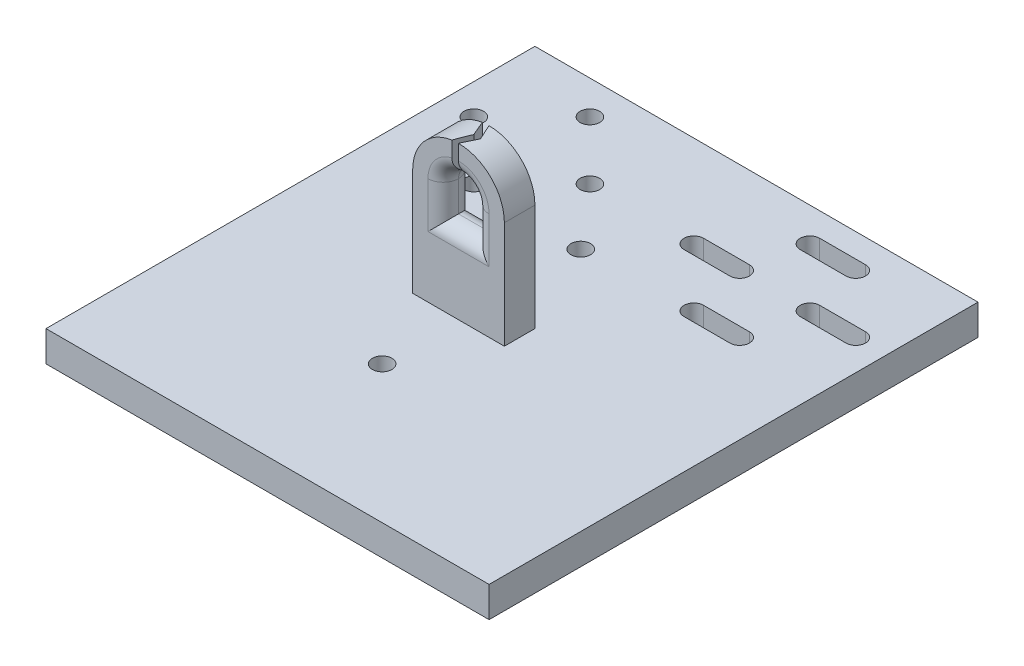
from build123d import *

# Parameters (mm, degrees)
SKETCH2_W           = 65
SKETCH2_H           = 30
BOSS_EXTRUDE1_DEPTH = 5
SKETCH3_R           = 1.6
CUT_EXTRUDE1_DEPTH  = 37.142080737
SKETCH5_W           = 30
SKETCH5_H           = 5
BOSS_EXTRUDE2_DEPTH = 7.5
CUT_EXTRUDE2_DEPTH  = 10
SKETCH7_W           = 72.5
SKETCH7_H           = 5
BOSS_EXTRUDE3_DEPTH = 50
BOSS_EXTRUDE4_DEPTH = 5
BOSS_EXTRUDE5_DEPTH = 5
SKETCH6_R           = 1.6
CUT_EXTRUDE3_DEPTH  = 10
CUT_EXTRUDE4_DEPTH  = 79.302298817
FILLET1_R           = 2.5


with BuildPart() as part:
    # Sketch2 → Boss-Extrude1 (new body)
    with BuildSketch(Plane(origin=(0, 0, 0), x_dir=(1, 0, 0), z_dir=(0, 1, 0))):
        Rectangle(SKETCH2_W, SKETCH2_H)
    extrude(amount=BOSS_EXTRUDE1_DEPTH)

    # Sketch3 → Cut-Extrude1 (cut, through all)
    with BuildSketch(Plane(origin=(0, 5, 0), x_dir=(1, 0, 0), z_dir=(0, 1, 0))):
        with Locations(Location((-27.5, 0, 0), (0, 0, 270))):
            Circle(SKETCH3_R)
        with Locations(Location((-18, 9.5, 0), (0, 0, 270))):
            Circle(SKETCH3_R)
        with Locations(Location((-8.5, 0, 0), (0, 0, 270))):
            Circle(SKETCH3_R)
        with Locations(Location((-18, -9.5, 0), (0, 0, 270))):
            Circle(SKETCH3_R)
        with Locations(Location((18, -9.5, 0), (0, 0, 90))):
            Circle(SKETCH3_R)
        with Locations(Location((27.5, 0, 0), (0, 0, 90))):
            Circle(SKETCH3_R)
        with Locations(Location((18, 9.5, 0), (0, 0, 90))):
            Circle(SKETCH3_R)
        with Locations(Location((8.5, 0, 0), (0, 0, 90))):
            Circle(SKETCH3_R)
    extrude(amount=-CUT_EXTRUDE1_DEPTH, mode=Mode.SUBTRACT)

    # Sketch5 → Boss-Extrude2 (add)
    with BuildSketch(Plane(origin=(32.5, 0, 0), x_dir=(0, 0, -1), z_dir=(1, 0, 0))):
        with Locations((0, 2.5)):
            Rectangle(SKETCH5_W, SKETCH5_H)
    extrude(amount=BOSS_EXTRUDE2_DEPTH)

    # Sketch4 → Cut-Extrude2 (cut)
    with BuildSketch(Plane(origin=(0, 5, 0), x_dir=(1, 0, 0), z_dir=(0, 1, 0))):
        with BuildLine():
            Line((8.5, 1.6), (16, 1.6))
            ThreePointArc((16, 1.6), (17.6, 0), (16, -1.6))
            Line((16, -1.6), (8.5, -1.6))
            ThreePointArc((8.5, -1.6), (6.9, 0), (8.5, 1.6))
        make_face()
        with BuildLine():
            Line((27.5, 1.6), (35, 1.6))
            ThreePointArc((35, 1.6), (36.6, 0), (35, -1.6))
            Line((35, -1.6), (27.5, -1.6))
            ThreePointArc((27.5, -1.6), (25.9, 0), (27.5, 1.6))
        make_face()
        with BuildLine():
            Line((18, -7.9), (25.5, -7.9))
            ThreePointArc((25.5, -7.9), (27.1, -9.5), (25.5, -11.1))
            Line((25.5, -11.1), (18, -11.1))
            ThreePointArc((18, -11.1), (16.4, -9.5), (18, -7.9))
        make_face()
        with BuildLine():
            Line((18, 11.1), (25.5, 11.1))
            ThreePointArc((25.5, 11.1), (27.1, 9.5), (25.5, 7.9))
            Line((25.5, 7.9), (18, 7.9))
            ThreePointArc((18, 7.9), (16.4, 9.5), (18, 11.1))
        make_face()
    extrude(amount=-CUT_EXTRUDE2_DEPTH, mode=Mode.SUBTRACT)

    # Sketch7 → Boss-Extrude3 (add)
    with BuildSketch(Plane.XY.offset(15)):
        with Locations((3.75, 2.5)):
            Rectangle(SKETCH7_W, SKETCH7_H)
    extrude(amount=BOSS_EXTRUDE3_DEPTH)

    # Sketch10 → Boss-Extrude4 (add)
    with BuildSketch(Plane.XY.offset(25)):
        Polygon((-7.5, 5), (7.5, 5), (7.5, 22.5), (2.5, 22.5), (2.5, 17.5), (-2.5, 17.5), (-2.5, 22.5), (-7.5, 22.5), align=None)
    extrude(amount=BOSS_EXTRUDE4_DEPTH)

    # Sketch11 → Boss-Extrude5 (add)
    with BuildSketch(Plane.XY.offset(30)):
        with BuildLine():
            Line((-7.5, 22.5), (-2.5, 22.5))
            ThreePointArc((-2.5, 22.5), (0, 25), (2.5, 22.5))
            Line((2.5, 22.5), (7.5, 22.5))
            ThreePointArc((7.5, 22.5), (0, 30), (-7.5, 22.5))
        make_face()
    extrude(amount=-BOSS_EXTRUDE5_DEPTH)

    # Sketch6 → Cut-Extrude3 (cut)
    with BuildSketch(Plane.XZ):
        with Locations(Location((0, 42.5, 0), (0, 0, 270))):
            Circle(SKETCH6_R)
        with Locations(Location((0, 10, 0), (0, 0, 270))):
            Circle(SKETCH6_R)
    extrude(amount=-CUT_EXTRUDE3_DEPTH, mode=Mode.SUBTRACT)

    # Sketch14 → Cut-Extrude4 (cut, through all)
    with BuildSketch(Plane(origin=(0, 17.5, 0), x_dir=(1, 0, 0), z_dir=(0, 1, 0))):
        Polygon((-1.091089451, -25), (0, -27.5), (-1.091089451, -30), (0, -30), (1.091089451, -27.5), (0, -25), align=None)
    extrude(amount=CUT_EXTRUDE4_DEPTH, mode=Mode.SUBTRACT)

    # Fillet1
    fillet1_edges = [part.edges().sort_by_distance(p)[0] for p in [
        (-2.5, 20, 25),
        (1.767766953, 24.267766953, 25),
        (1.767766953, 24.267766953, 30),
        (-2.118693421, 23.827078817, 30),
        (-2.118693421, 23.827078817, 25),
        (2.5, 20, 25),
        (0, 17.5, 25),
        (2.5, 20, 30),
        (0, 17.5, 30),
        (-2.5, 20, 30),
    ]]
    fillet(fillet1_edges, radius=FILLET1_R - 0.0001)  # a hair under: the kernel refuses the full size


solid = part.part
